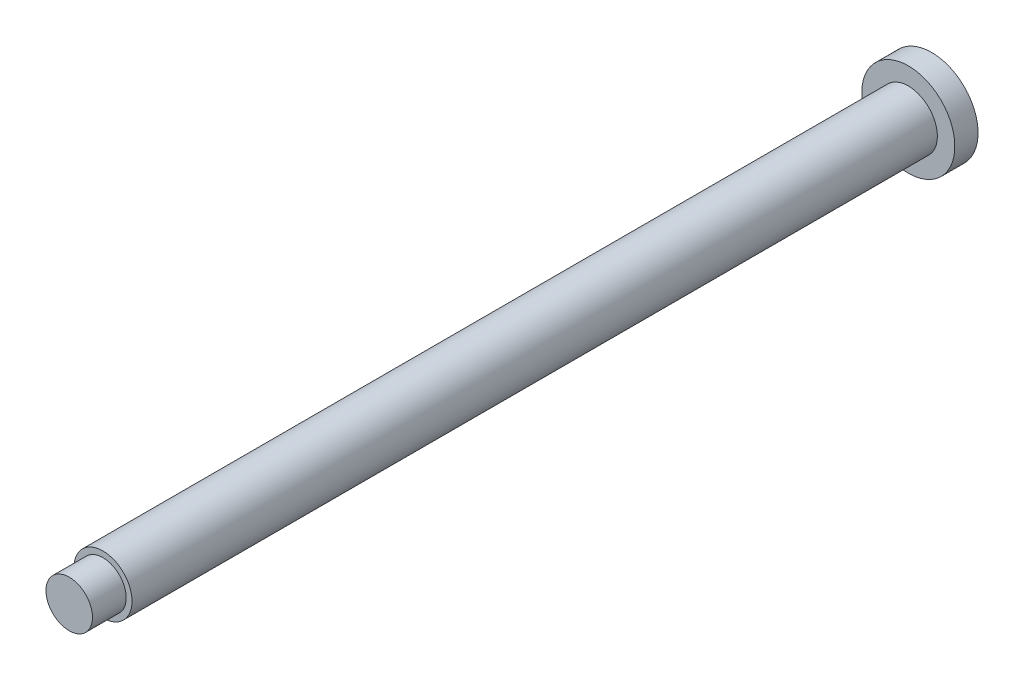
from build123d import *

# Parameters (mm, degrees)
SKETCH1_R           = 2.5
BOSS_EXTRUDE1_DEPTH = 69.25
SKETCH2_R           = 4
BOSS_EXTRUDE2_DEPTH = 2
SKETCH3_R           = 2.05
CUT_EXTRUDE1_DEPTH  = 3
SKETCH4_R           = 2
BOSS_EXTRUDE3_DEPTH = 2.9


with BuildPart() as part:
    # Sketch1 → Boss-Extrude1 (new body)
    with BuildSketch(Plane(origin=(0, 0, 0), x_dir=(0, 1, 0), z_dir=(0, 0, 1))):
        Circle(SKETCH1_R)
    extrude(amount=BOSS_EXTRUDE1_DEPTH)

    # Sketch2 → Boss-Extrude2 (add)
    with BuildSketch(Plane(origin=(0, 0, 0), x_dir=(1, 0, 0), z_dir=(0, 0, -1))):
        Circle(SKETCH2_R)
    extrude(amount=BOSS_EXTRUDE2_DEPTH)

    # Sketch3 → Cut-Extrude1 (cut)
    with BuildSketch(Plane(origin=(0, 0, -2), x_dir=(1, 0, 0), z_dir=(0, 0, -1))):
        Circle(SKETCH3_R)
    extrude(amount=-CUT_EXTRUDE1_DEPTH, mode=Mode.SUBTRACT)

    # Sketch4 → Boss-Extrude3 (add)
    with BuildSketch(Plane.XY.offset(69.25)):
        Circle(SKETCH4_R)
    extrude(amount=BOSS_EXTRUDE3_DEPTH)


solid = part.part
